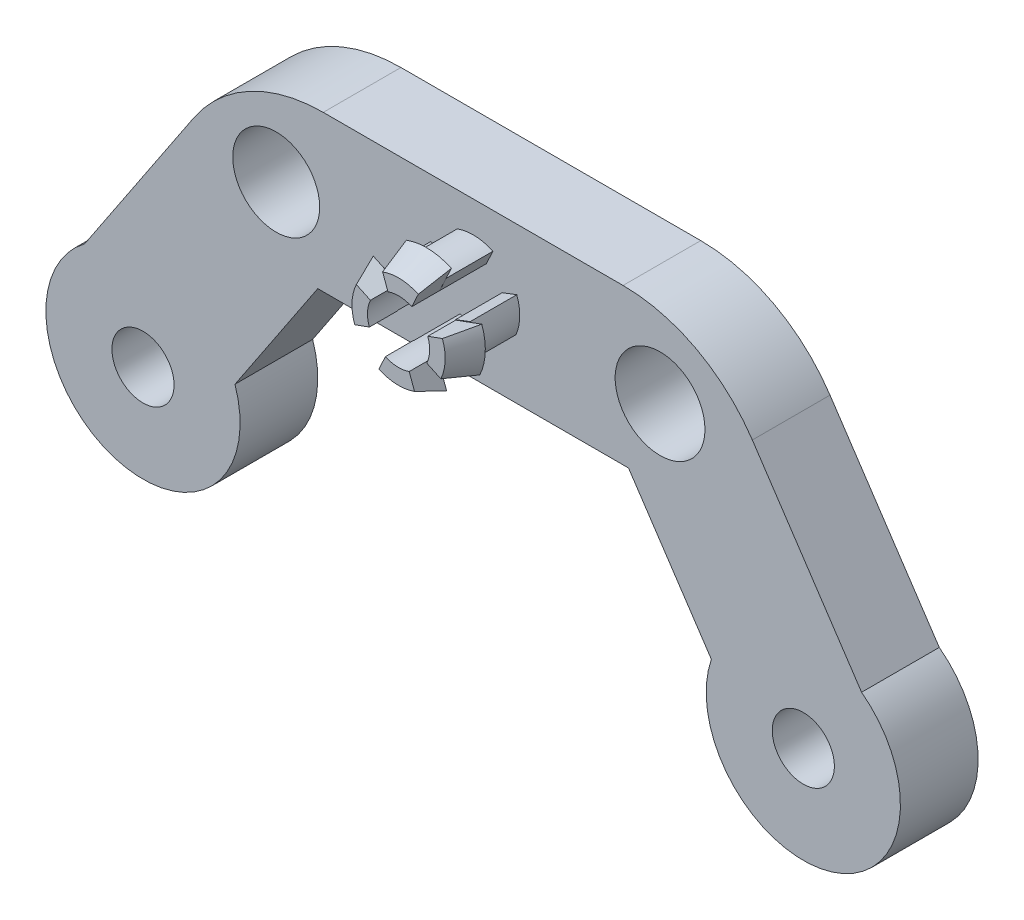
from build123d import *

# Parameters (mm, degrees)
SZKIC1_R                    = 2
DODANIE_WYCI_GNI_CIE1_DEPTH = 5
SZKIC2_R                    = 2.797439786
SZKIC2_R_2                  = 2.890763472
WYTNIJ_WYCI_GNI_CIE1_DEPTH  = 10
ZAOKR_GLENIE1_R             = 10
DODANIE_WYCI_GNI_CIE2_DEPTH = 3
OBR_T1_ANGLE                = 45
SZYK_KO_OWY1_COUNT          = 4


# Read off the part's stored shape, not the designer's step: Obrót1
with BuildPart() as part:
    # Szkic1 → Dodanie-wyciągnięcie1 (new body)
    with BuildSketch(Plane.XY):
        with BuildLine():
            Line((-15, 0), (15, 0))
            Line((15, 0), (25, -15))
            ThreePointArc((25, -15), (23.099320571, -25.970135126), (15.330219835, -17.995329753))
            Line((15.330219835, -17.995329753), (10, -10))
            Line((10, -10), (-10, -10))
            Line((-10, -10), (-15.330219835, -17.995329753))
            ThreePointArc((-15.330219835, -17.995329753), (-23.099320571, -25.970135126), (-25, -15))
            Line((-25, -15), (-15, 0))
        make_face()
        with Locations((-21.25, -20)):
            Circle(SZKIC1_R, mode=Mode.SUBTRACT)
        with Locations((21.25, -20)):
            Circle(SZKIC1_R, mode=Mode.SUBTRACT)
    extrude(amount=DODANIE_WYCI_GNI_CIE1_DEPTH)

    # Szkic2 → Wytnij-wyciągnięcie1 (cut)
    with BuildSketch(Plane.XY.offset(5)):
        with Locations((-12.676758493, -5.398654495)):
            Circle(SZKIC2_R)
        with Locations((12.029040905, -5.398654495)):
            Circle(SZKIC2_R_2)
    extrude(amount=-WYTNIJ_WYCI_GNI_CIE1_DEPTH, mode=Mode.SUBTRACT)

    # Zaokrąglenie1
    zaokr_glenie1_edges = [part.edges().sort_by_distance(p)[0] for p in [
        (-15, 0, 2.5),
        (15, 0, 2.5),
    ]]
    fillet(zaokr_glenie1_edges, radius=ZAOKR_GLENIE1_R)

    # Szkic3 → Dodanie-wyciągnięcie2 (add)
    with BuildSketch(Plane.XY.offset(5)):
        with BuildLine():
            Line((-0.67948159, -3.118961784), (-1.019222385, -2.178442676))
            ThreePointArc((-1.019222385, -2.178442676), (0.136924764, -2.003126361), (1.272268294, -2.283139056))
            Line((1.272268294, -2.283139056), (0.848178863, -3.188759371))
            ThreePointArc((0.848178863, -3.188759371), (0.091283176, -3.002084241), (-0.67948159, -3.118961784))
        make_face()
        with BuildLine():
            Line((1.870588598, -4.292258312), (2.805882897, -3.938387468))
            ThreePointArc((2.805882897, -3.938387468), (2.999104941, -5.073277223), (2.750688951, -6.197376422))
            Line((2.750688951, -6.197376422), (1.833792634, -5.798250948))
            ThreePointArc((1.833792634, -5.798250948), (1.999403294, -5.048851482), (1.870588598, -4.292258312))
        make_face()
        with BuildLine():
            Line((0.692421598, -6.876313495), (1.038632398, -7.814470242))
            ThreePointArc((1.038632398, -7.814470242), (-0.113665121, -7.997845933), (-1.248768691, -7.727742062))
            Line((-1.248768691, -7.727742062), (-0.832512461, -6.818494708))
            ThreePointArc((-0.832512461, -6.818494708), (-0.075776747, -6.998563956), (0.692421598, -6.876313495))
        make_face()
        with BuildLine():
            Line((-1.884973157, -5.668487992), (-2.827459736, -6.002731988))
            ThreePointArc((-2.827459736, -6.002731988), (-2.996499858, -4.855125566), (-2.717538259, -3.72917908))
            Line((-2.717538259, -3.72917908), (-1.811692173, -4.152786053))
            ThreePointArc((-1.811692173, -4.152786053), (-1.997666572, -4.903417044), (-1.884973157, -5.668487992))
        make_face()
    extrude(amount=DODANIE_WYCI_GNI_CIE2_DEPTH)

    # Obrót1 outline → Obrót1 (revolve)
    with BuildSketch(Plane(origin=(0, -5, 0), x_dir=(0.42261826174070005, 0.9063077870366497, 0), z_dir=(0.9063077870366497, -0.42261826174070005, 0))):
        Polygon((3, 9.8), (2, 9.8), (2, 8), (3.781968342, 8), align=None)
    obr_t1 = revolve(axis=Axis((0, -5, 0), (0, 0, 1)), revolution_arc=OBR_T1_ANGLE)

    # Szyk kołowy1: Obrót1 ×4 about axis
    szyk_ko_owy1_axis = Axis((0, -5, 5), (0, 0, 1))
    for i in range(1, SZYK_KO_OWY1_COUNT):
        add(obr_t1.rotate(szyk_ko_owy1_axis, i * 360 / SZYK_KO_OWY1_COUNT))


solid = part.part
